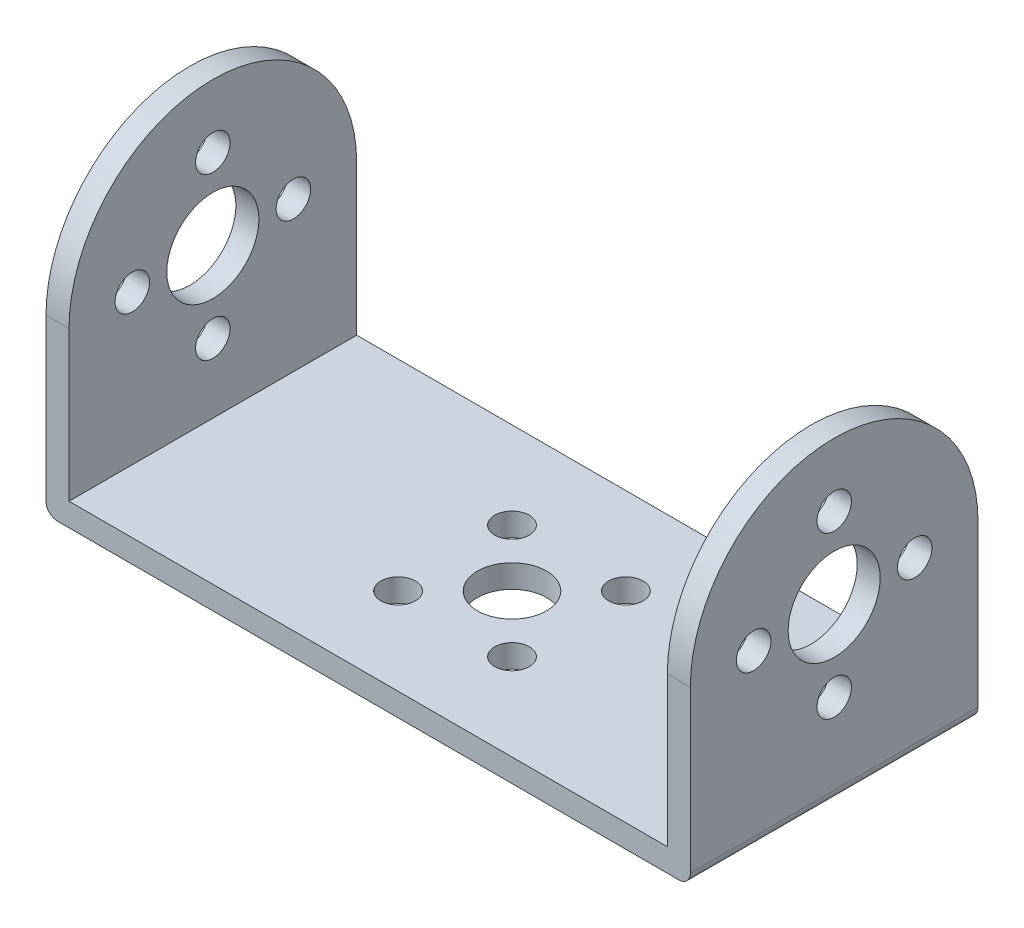
from build123d import *

# Parameters (mm, degrees)
SKETCH_1_W          = 56
SKETCH_1_H          = 25
EXTRUDE_1_DEPTH     = 2
SKETCH_2_R          = 3
SKETCH_2_R_2        = 1.5
CUT_EXTRUDE_1_DEPTH = 39.082744359
EXTRUDE_2_DEPTH     = 2
CUT_EXTRUDE_2_REACH = 65.776
SKETCH_4_R          = 4
SKETCH_4_R_2        = 1.5
FILLET_1_R          = 1


with BuildPart() as part:
    # 草图1 → 凸台-拉伸1 (new body)
    with BuildSketch(Plane(origin=(0, 0, 0), x_dir=(1, 0, 0), z_dir=(0, 1, 0))):
        with Locations((7.654255319, 0.731382979)):
            Rectangle(SKETCH_1_W, SKETCH_1_H)
    extrude(amount=EXTRUDE_1_DEPTH)

    # 草图2 → 切除-拉伸1 (cut, through all)
    with BuildSketch(Plane(origin=(0, 2, 0), x_dir=(1, 0, 0), z_dir=(0, 1, 0))):
        with Locations((7.654255319, 0.731382979)):
            Circle(SKETCH_2_R)
        with Locations((12.604002787, 5.681130447)):
            Circle(SKETCH_2_R_2)
        with Locations((2.704507851, 5.681130447)):
            Circle(SKETCH_2_R_2)
        with Locations((12.604002787, -4.21836449)):
            Circle(SKETCH_2_R_2)
        with Locations((2.704507851, -4.21836449)):
            Circle(SKETCH_2_R_2)
    extrude(amount=-CUT_EXTRUDE_1_DEPTH, mode=Mode.SUBTRACT)

    # 草图3 → 凸台-拉伸2 (add)
    with BuildSketch(Plane.ZY.offset(20.345744681)):
        with BuildLine():
            Line((-13.231382979, 15), (-13.231382979, 2))
            Line((-13.231382979, 2), (11.768617021, 2))
            Line((11.768617021, 2), (11.768617021, 15))
            ThreePointArc((11.768617021, 15), (-0.731382979, 27.5), (-13.231382979, 15))
        make_face()
    extrude_2 = extrude(amount=-EXTRUDE_2_DEPTH)

    # 草图4 → 切除-拉伸2 (cut, up to next)
    with BuildSketch(Plane.ZY.offset(20.345744681), mode=Mode.PRIVATE) as cut_extrude_2_sk1:
        with Locations((-0.731382979, 15)):
            Circle(SKETCH_4_R)
    cut_extrude_2_tool1 = extrude(cut_extrude_2_sk1.sketch, amount=-CUT_EXTRUDE_2_REACH, mode=Mode.PRIVATE) & part.part
    # 草图4 → 切除-拉伸2 (cut, up to next)
    with BuildSketch(Plane.ZY.offset(20.345744681), mode=Mode.PRIVATE) as cut_extrude_2_sk2:
        with Locations((-0.731382979, 22)):
            Circle(SKETCH_4_R_2)
    cut_extrude_2_tool2 = extrude(cut_extrude_2_sk2.sketch, amount=-CUT_EXTRUDE_2_REACH, mode=Mode.PRIVATE) & part.part
    # 草图4 → 切除-拉伸2 (cut, up to next)
    with BuildSketch(Plane.ZY.offset(20.345744681), mode=Mode.PRIVATE) as cut_extrude_2_sk3:
        with Locations((6.268617021, 15)):
            Circle(SKETCH_4_R_2)
    cut_extrude_2_tool3 = extrude(cut_extrude_2_sk3.sketch, amount=-CUT_EXTRUDE_2_REACH, mode=Mode.PRIVATE) & part.part
    # 草图4 → 切除-拉伸2 (cut, up to next)
    with BuildSketch(Plane.ZY.offset(20.345744681), mode=Mode.PRIVATE) as cut_extrude_2_sk4:
        with Locations((-0.731382979, 8)):
            Circle(SKETCH_4_R_2)
    cut_extrude_2_tool4 = extrude(cut_extrude_2_sk4.sketch, amount=-CUT_EXTRUDE_2_REACH, mode=Mode.PRIVATE) & part.part
    # 草图4 → 切除-拉伸2 (cut, up to next)
    with BuildSketch(Plane.ZY.offset(20.345744681), mode=Mode.PRIVATE) as cut_extrude_2_sk5:
        with Locations((-7.731382979, 15)):
            Circle(SKETCH_4_R_2)
    cut_extrude_2_tool5 = extrude(cut_extrude_2_sk5.sketch, amount=-CUT_EXTRUDE_2_REACH, mode=Mode.PRIVATE) & part.part
    cut_extrude_2_1 = cut_extrude_2_tool1.solids().sort_by_distance((-20.345745, 15, -0.731383))[0]
    add(cut_extrude_2_1, mode=Mode.SUBTRACT)
    cut_extrude_2_2 = cut_extrude_2_tool2.solids().sort_by_distance((-20.345745, 22, -0.731383))[0]
    add(cut_extrude_2_2, mode=Mode.SUBTRACT)
    cut_extrude_2_3 = cut_extrude_2_tool3.solids().sort_by_distance((-20.345745, 15, 6.268617))[0]
    add(cut_extrude_2_3, mode=Mode.SUBTRACT)
    cut_extrude_2_4 = cut_extrude_2_tool4.solids().sort_by_distance((-20.345745, 8, -0.731383))[0]
    add(cut_extrude_2_4, mode=Mode.SUBTRACT)
    cut_extrude_2_5 = cut_extrude_2_tool5.solids().sort_by_distance((-20.345745, 15, -7.731383))[0]
    add(cut_extrude_2_5, mode=Mode.SUBTRACT)
    cut_extrude_2 = cut_extrude_2_1 + cut_extrude_2_2 + cut_extrude_2_3 + cut_extrude_2_4 + cut_extrude_2_5  # 切除-拉伸2 as one shape, for the pattern or mirror that repeats it

    # 镜向1: 凸台-拉伸2, 切除-拉伸2 across plane
    add(extrude_2.mirror(Plane.ZY.offset(-7.654255319)))
    add(cut_extrude_2.mirror(Plane.ZY.offset(-7.654255319)), mode=Mode.SUBTRACT)

    # 圆角1
    fillet_1_edges = [part.edges().sort_by_distance(p)[0] for p in [
        (35.654255319, 0, -0.731382979),
        (-20.345744681, 0, -0.731382979),
    ]]
    fillet(fillet_1_edges, radius=FILLET_1_R)


solid = part.part
